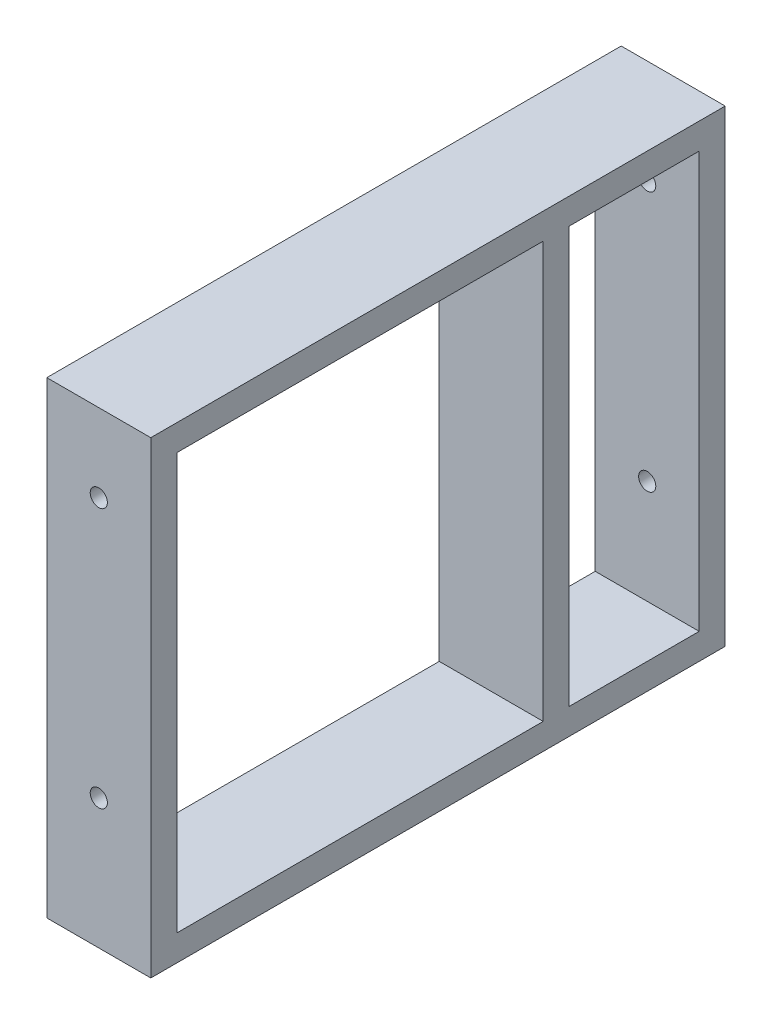
from build123d import *

# Parameters (mm, degrees)
SKETCH1_W                      = 110.475
SKETCH1_H                      = 90
SKETCH1_W_2                    = 70.475
SKETCH1_H_2                    = 80
SKETCH1_W_3                    = 25
BOSS_EXTRUDE1_DEPTH            = 20
M4_CLEARANCE_HOLE1_D           = 4.5
M4_CLEARANCE_HOLE1_DEPTH       = 7.8
M4_CLEARANCE_HOLE1_TIP         = 1.351936393
M4X0_7_TAPPED_HOLE1_AT_2_COUNT = 2
M4X0_7_TAPPED_HOLE1_AT_2_PITCH = 50


with BuildPart() as part:
    # Sketch1 → Boss-Extrude1 (new body)
    with BuildSketch(Plane(origin=(0, 0, 0), x_dir=(0, 0, -1), z_dir=(1, 0, 0))):
        Rectangle(SKETCH1_W, SKETCH1_H)
        with Locations((-15, 0)):
            Rectangle(SKETCH1_W_2, SKETCH1_H_2, mode=Mode.SUBTRACT)
        with Locations((37.7375, 0)):
            Rectangle(SKETCH1_W_3, SKETCH1_H_2, mode=Mode.SUBTRACT)
    extrude(amount=BOSS_EXTRUDE1_DEPTH)

    # M4 Clearance Hole1
    with Locations(Plane(origin=(0, -40, 0), x_dir=(1, 0, 0), z_dir=(0, 1, 0))):
        with Locations((10, 30.2375), (10, -44.7625)):
            Hole(M4_CLEARANCE_HOLE1_D / 2, depth=M4_CLEARANCE_HOLE1_DEPTH)
            with Locations((0, 0, -(M4_CLEARANCE_HOLE1_DEPTH + M4_CLEARANCE_HOLE1_TIP / 2))):  # 118° drill point
                Cone(0, M4_CLEARANCE_HOLE1_D / 2, M4_CLEARANCE_HOLE1_TIP, mode=Mode.SUBTRACT)

    # Sketch6 → M4x0.7 Tapped Hole1 (revolve, cut)
    with BuildSketch(Plane(origin=(10, 30, 55.2375), x_dir=(0, -1, 0), z_dir=(1, 0, 0))):
        Polygon((0, 0), (0, 11.091420021), (1.65, 10.1), (1.65, 0), align=None)
    m4x0_7_tapped_hole1 = revolve(axis=Axis((10, 30, 61.5875), (0, 0, -1)), mode=Mode.SUBTRACT)

    # M4x0.7 Tapped Hole1 at 2: M4x0.7 Tapped Hole1 ×2
    with Locations(*[(0, -i * M4X0_7_TAPPED_HOLE1_AT_2_PITCH, 0) for i in range(1, M4X0_7_TAPPED_HOLE1_AT_2_COUNT)]):
        add(m4x0_7_tapped_hole1, mode=Mode.SUBTRACT)

    # Mirror1: M4x0.7 Tapped Hole1 across plane
    add(m4x0_7_tapped_hole1.mirror(Plane.XY), mode=Mode.SUBTRACT)

    # Mirror1 copy 1 sketch → Mirror1 copy 1 (revolve, cut)
    with BuildSketch(Plane(origin=(10, -20, -55.2375), x_dir=(0, -1, 0), z_dir=(1, 0, 0))):
        Polygon((0, 0), (0, -11.091420021), (1.65, -10.1), (1.65, 0), align=None)
    revolve(axis=Axis((10, -20, -61.5875), (0, 0, -1)), mode=Mode.SUBTRACT)


solid = part.part
